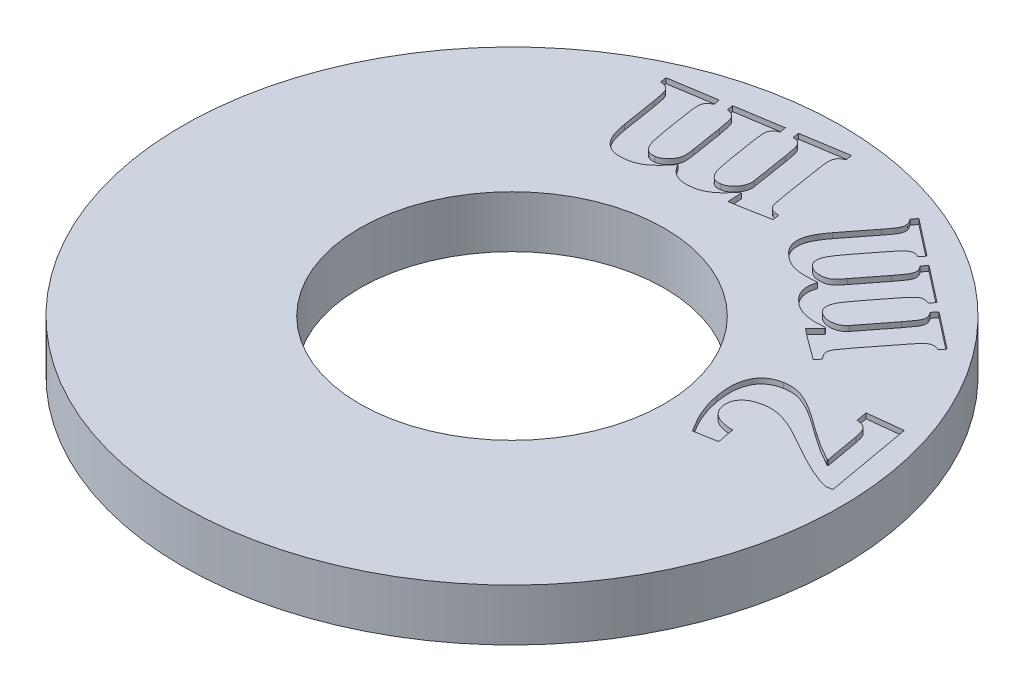
from build123d import *

# Parameters (mm, degrees)
SKETCH1_R           = 12.7
BOSS_EXTRUDE1_DEPTH = 2
SKETCH2_R           = 5.8674
CUT_EXTRUDE1_DEPTH  = 19.071524562
CUT_EXTRUDE2_DEPTH  = 0.2


with BuildPart() as part:
    # Sketch1 → Boss-Extrude1 (new body)
    with BuildSketch(Plane(origin=(0, 0, 0), x_dir=(1, 0, 0), z_dir=(0, 1, 0))):
        Circle(SKETCH1_R)
    extrude(amount=BOSS_EXTRUDE1_DEPTH)

    # Sketch2 → Cut-Extrude1 (cut, through all)
    with BuildSketch(Plane(origin=(0, 0, 0), x_dir=(-1, 0, 0), z_dir=(0, -1, 0))):
        Circle(SKETCH2_R)
    extrude(amount=-CUT_EXTRUDE1_DEPTH, mode=Mode.SUBTRACT)

    # Sketch4 → Cut-Extrude2 (cut)
    with BuildSketch(Plane(origin=(0, 2, 0), x_dir=(1, 0, 0), z_dir=(0, 1, 0))):
        with BuildLine():
            add(Edge.make_bspline(
                [(10.657175979, 2.594019097), (10.65013064, 2.630831583), (10.636969406, 2.699600141), (10.614138172, 2.794705295), (10.589733244, 2.874375061), (10.561272904, 2.939067494), (10.531020983, 2.99353319), (10.494812939, 3.038568652), (10.452899957, 3.075923763), (10.405274192, 3.106357847), (10.349988215, 3.13102197), (10.285264647, 3.148965447), (10.210866978, 3.163737215), (10.157483095, 3.168212073), (10.129111743, 3.170590278)],
                knots=[0, 0, 0, 0, 1.540311631, 2.877420744, 4.019047234, 4.959142214, 5.777829076, 6.572764425, 7.321593786, 8.075735676, 8.887004588, 9.799891039, 10.830732, 12, 12, 12, 12], degree=3))
            Line((10.129111743, 3.170590278), (10.054146465, 3.590616319))
            Line((10.054146465, 3.590616319), (11.377063132, 3.739444444))
            Line((11.377063132, 3.739444444), (11.972375632, 0.394670139))
            Line((11.972375632, 0.394670139), (11.73094334, 0.351675347))
            add(Edge.make_bspline(
                [(11.73094334, 0.351675347), (11.666021298, 0.368480839), (11.531212131, 0.403377067), (11.326414737, 0.474445449), (11.110180307, 0.559425855), (10.882988887, 0.660070864), (10.645158868, 0.776715276), (10.394395938, 0.905922065), (10.131048372, 1.048986702), (9.9528541, 1.151989425), (9.861221118, 1.204956597)],
                knots=[0, 0, 0, 0, 0.780349875, 1.620379058, 2.521161756, 3.484490423, 4.511830184, 5.604229563, 6.768021061, 8, 8, 8, 8], degree=3))
            add(Edge.make_bspline(
                [(9.861221118, 1.204956597), (9.776443058, 1.253652173), (9.615930318, 1.345848907), (9.387059411, 1.473484458), (9.181803351, 1.579516376), (8.998168575, 1.667527983), (8.830111188, 1.739289307), (8.671736429, 1.799305225), (8.518737568, 1.8433924), (8.371972803, 1.879309741), (8.228064992, 1.900559713), (8.085286383, 1.908174145), (7.94232826, 1.903319711), (7.848085123, 1.889024598), (7.80077841, 1.881848958)],
                knots=[0, 0, 0, 0, 1.588748718, 3.008023671, 4.257940554, 5.342391522, 6.316243066, 7.226933507, 8.092329584, 8.902015177, 9.680651395, 10.452110241, 11.223014214, 12, 12, 12, 12], degree=3))
            add(Edge.make_bspline(
                [(7.80077841, 1.881848958), (7.737810367, 1.868570311), (7.617604939, 1.843221491), (7.453187274, 1.778906093), (7.312606985, 1.697337928), (7.217707497, 1.610851073), (7.156248473, 1.534763117), (7.11835972, 1.475393068), (7.090083841, 1.412684467), (7.066648765, 1.348152535), (7.054692086, 1.279597589), (7.047209551, 1.208811476), (7.049839269, 1.135133242), (7.057246716, 1.085833888), (7.061047507, 1.060538194)],
                knots=[0, 0, 0, 0, 1.856671383, 3.544368997, 5.077513395, 6.528031651, 7.222788016, 7.900293924, 8.555813474, 9.207192858, 9.877674324, 10.560153428, 11.261209002, 12, 12, 12, 12], degree=3))
            add(Edge.make_bspline(
                [(7.061047507, 1.060538194), (7.071502485, 1.013917266), (7.091847681, 0.923193798), (7.156333505, 0.800294722), (7.242613348, 0.694498267), (7.333740463, 0.622353436), (7.417801846, 0.575049385), (7.488441553, 0.542731657), (7.566717952, 0.516901122), (7.650772556, 0.493347798), (7.742391153, 0.476481532), (7.840439275, 0.461498893), (7.945805633, 0.453265626), (8.018314011, 0.450968067), (8.055439868, 0.449791667)],
                knots=[0, 0, 0, 0, 1.33944009, 2.606525719, 3.862934898, 5.158019576, 5.84800628, 6.574523544, 7.339672684, 8.164919944, 9.0287774, 9.958789578, 10.954856145, 12, 12, 12, 12], degree=3))
            Line((8.055439868, 0.449791667), (8.172297507, -0.207256944))
            Line((8.172297507, -0.207256944), (7.310196812, -0.360494792))
            add(Edge.make_bspline(
                [(7.310196812, -0.360494792), (7.269943559, -0.295206555), (7.194332463, -0.172570127), (7.091280305, 0.001165699), (7.007559915, 0.153805397), (6.917495892, 0.325751817), (6.828566235, 0.528709765), (6.734746947, 0.771533586), (6.660981212, 1.028705946), (6.626054599, 1.207222275), (6.607948548, 1.299765625)],
                knots=[0, 0, 0, 0, 1.013852355, 1.904404784, 2.669660784, 3.314893955, 4.4694696, 5.596276395, 6.753903144, 8, 8, 8, 8], degree=3))
            add(Edge.make_bspline(
                [(6.607948548, 1.299765625), (6.594373085, 1.385581768), (6.568481438, 1.549253623), (6.554034422, 1.786495935), (6.559902757, 2.002451995), (6.590743901, 2.197205894), (6.641439791, 2.370424151), (6.708565837, 2.523254421), (6.792300347, 2.655975238), (6.896085737, 2.76542574), (7.014232975, 2.855427337), (7.146085533, 2.927207536), (7.290765983, 2.983855708), (7.39392888, 3.005259932), (7.446898201, 3.01625)],
                knots=[0, 0, 0, 0, 1.443267886, 2.752656116, 3.944361917, 5.026747142, 6.020055427, 6.935958526, 7.793169878, 8.6141069, 9.428864088, 10.251639209, 11.102298531, 12, 12, 12, 12], degree=3))
            add(Edge.make_bspline(
                [(7.446898201, 3.01625), (7.494563647, 3.02346036), (7.588424347, 3.037658685), (7.729716904, 3.04210554), (7.868111573, 3.030406083), (8.006902768, 3.006267175), (8.149697995, 2.963320645), (8.302330261, 2.904522597), (8.466281885, 2.826207866), (8.611654299, 2.748407674), (8.737278614, 2.673549672), (8.844909038, 2.607699414), (8.96123916, 2.529289408), (9.090383567, 2.444265965), (9.229102901, 2.348034363), (9.378074292, 2.241872945), (9.537955368, 2.126144512), (9.647783356, 2.045099111), (9.704675979, 2.003116319)],
                knots=[0, 0, 0, 0, 0.908484052, 1.788946884, 2.657881961, 3.523717051, 4.440330464, 5.464678491, 6.605413212, 7.864114422, 8.572400302, 9.362740296, 10.242957687, 11.217337518, 12.278341761, 13.426209815, 14.666736238, 16, 16, 16, 16], degree=3))
            add(Edge.make_bspline(
                [(9.704675979, 2.003116319), (9.811805931, 1.92809611), (10.023407319, 1.779917378), (10.291371818, 1.609086139), (10.497607624, 1.48887768), (10.631292817, 1.409907135), (10.747529002, 1.346035088), (10.818829378, 1.308148721), (10.851203757, 1.290946181)],
                knots=[0, 0, 0, 0, 1.742825355, 3.442401069, 4.232730782, 4.923996937, 5.511434123, 6, 6, 6, 6], degree=3))
            Line((10.851203757, 1.290946181), (10.887583965, 1.297560764))
            Line((10.887583965, 1.297560764), (10.657175979, 2.594019097))
        make_face()
        with BuildLine():
            Line((6.446112276, 5.621046804), (6.418551512, 5.656324582))
            add(Edge.make_bspline(
                [(6.418551512, 5.656324582), (6.345103003, 5.650481726), (6.205690041, 5.639391375), (6.006049673, 5.640001619), (5.827169527, 5.650699674), (5.666856777, 5.67597167), (5.521469939, 5.714933464), (5.387561193, 5.768451828), (5.261579098, 5.83414063), (5.185430088, 5.889090651), (5.147449081, 5.916498193)],
                knots=[0, 0, 0, 0, 1.328700104, 2.522011983, 3.598465663, 4.558669638, 5.444794913, 6.307777922, 7.155966722, 8, 8, 8, 8], degree=3))
            add(Edge.make_bspline(
                [(5.147449081, 5.916498193), (5.113549109, 5.943897718), (5.048106477, 5.996791479), (4.961452983, 6.081290035), (4.888569595, 6.165417061), (4.830459206, 6.250285271), (4.784446219, 6.336029232), (4.750511209, 6.423590405), (4.725338541, 6.51279674), (4.712276312, 6.605066622), (4.710185373, 6.700889708), (4.719470407, 6.800614492), (4.739279008, 6.904788894), (4.760550248, 6.974274273), (4.771520262, 7.010109304)],
                knots=[0, 0, 0, 0, 1.254723853, 2.422197594, 3.480533536, 4.455073735, 5.378270259, 6.276377898, 7.154433995, 8.041941717, 8.952311201, 9.908521309, 10.921381655, 12, 12, 12, 12], degree=3))
            add(Edge.make_bspline(
                [(4.771520262, 7.010109304), (4.691090698, 7.003656459), (4.538471998, 6.991411896), (4.321666343, 6.98846259), (4.129911724, 6.995416816), (3.960718577, 7.018564153), (3.808601542, 7.056299759), (3.667745769, 7.110172456), (3.535147857, 7.17881181), (3.454567942, 7.236924978), (3.414428248, 7.265873193)],
                knots=[0, 0, 0, 0, 1.366310217, 2.59263486, 3.670585393, 4.613332156, 5.479848919, 6.319088227, 7.162678639, 8, 8, 8, 8], degree=3))
            add(Edge.make_bspline(
                [(3.414428248, 7.265873193), (3.3775521, 7.295803428), (3.306764809, 7.353257376), (3.21306857, 7.444735382), (3.134735925, 7.535260481), (3.072420666, 7.626680072), (3.027114725, 7.721083516), (2.993029681, 7.816985205), (2.9748084, 7.916670154), (2.967827049, 8.01881721), (2.974809687, 8.124007378), (2.995095498, 8.231959079), (3.028806982, 8.342103336), (3.074329878, 8.45600405), (3.135236882, 8.572567121), (3.206795227, 8.695687314), (3.293019282, 8.822881794), (3.357079528, 8.907680315), (3.390174776, 8.951489512)],
                knots=[0, 0, 0, 0, 1.169264857, 2.244515684, 3.220319539, 4.113963992, 4.959955291, 5.792870505, 6.612950669, 7.447388896, 8.308923635, 9.201834464, 10.146760853, 11.141726431, 12.218423767, 13.382633535, 14.647798067, 16, 16, 16, 16], degree=3))
            Line((3.390174776, 8.951489512), (4.221407414, 10.019744721))
            add(Edge.make_bspline(
                [(4.221407414, 10.019744721), (4.253451667, 10.061583607), (4.315528507, 10.14263483), (4.402700621, 10.258852189), (4.474099835, 10.363054012), (4.52285553, 10.455601314), (4.552580969, 10.535251364), (4.563466398, 10.608503251), (4.558254548, 10.679867299), (4.53147758, 10.75154504), (4.489681708, 10.826689156), (4.454202161, 10.876320457), (4.435278942, 10.902791596)],
                knots=[0, 0, 0, 0, 1.558183804, 3.018548385, 4.296309646, 5.28770402, 6.105589718, 6.797073249, 7.462098622, 8.197436721, 9.038592567, 10, 10, 10, 10], degree=3))
            Line((4.435278942, 10.902791596), (4.585209498, 11.095716943))
            Line((4.585209498, 11.095716943), (5.996320609, 9.99769611))
            Line((5.996320609, 9.99769611), (5.846390053, 9.804770762))
            add(Edge.make_bspline(
                [(5.846390053, 9.804770762), (5.821598554, 9.814853431), (5.775331585, 9.833670142), (5.707363836, 9.85237221), (5.646143658, 9.858436215), (5.590929353, 9.853196728), (5.540343575, 9.836119226), (5.490007513, 9.81172786), (5.439948532, 9.776609976), (5.384915117, 9.732987716), (5.324969903, 9.670799848), (5.252764521, 9.589061458), (5.16514284, 9.485038198), (5.10380747, 9.40664927), (5.070278942, 9.36379854)],
                knots=[0, 0, 0, 0, 0.974495288, 1.818645247, 2.55789592, 3.203887047, 3.821953837, 4.492443581, 5.234959137, 6.043992897, 7.047297203, 8.374577793, 10.01818969, 12, 12, 12, 12], degree=3))
            Line((5.070278942, 9.36379854), (4.459532414, 8.578867985))
            add(Edge.make_bspline(
                [(4.459532414, 8.578867985), (4.427040039, 8.536727017), (4.36533113, 8.456693682), (4.279860313, 8.340926267), (4.207480509, 8.23488918), (4.144743666, 8.140152652), (4.093939387, 8.053261371), (4.055224804, 7.972382939), (4.025674683, 7.897486598), (4.007618905, 7.827463577), (3.999758774, 7.762907557), (3.999966382, 7.703395202), (4.005428339, 7.648104338), (4.021722039, 7.597238119), (4.045740851, 7.549179791), (4.078974228, 7.503189368), (4.121883321, 7.458704343), (4.154616135, 7.431294161), (4.171798039, 7.416906179)],
                knots=[0, 0, 0, 0, 1.888953508, 3.587465034, 5.107152686, 6.445866775, 7.620537267, 8.676590056, 9.626254862, 10.474157069, 11.23623705, 11.927603465, 12.58451522, 13.199276758, 13.811819934, 14.485105834, 15.204811187, 16, 16, 16, 16], degree=3))
            add(Edge.make_bspline(
                [(4.171798039, 7.416906179), (4.196907921, 7.398623115), (4.24575502, 7.363056452), (4.329546375, 7.32690278), (4.419900083, 7.306286873), (4.515987475, 7.298075567), (4.611843152, 7.301326536), (4.703352488, 7.308761322), (4.788476175, 7.328417137), (4.868537558, 7.362467429), (4.944132959, 7.410449543), (5.003782637, 7.463505766), (5.054181963, 7.517595359), (5.101176163, 7.571027473), (5.155289779, 7.638105142), (5.193805445, 7.686959904), (5.214697345, 7.713459999)],
                knots=[0, 0, 0, 0, 1.060451807, 2.062932707, 3.097103212, 4.220994073, 5.353228603, 6.376944908, 7.359261765, 8.328691766, 9.340596163, 10.410182602, 11.05076008, 11.870698325, 12.845011315, 14, 14, 14, 14], degree=3))
            Line((5.214697345, 7.713459999), (5.957735539, 8.66816486))
            add(Edge.make_bspline(
                [(5.957735539, 8.66816486), (5.982092993, 8.699319813), (6.027952625, 8.757977615), (6.090423825, 8.841053313), (6.142342187, 8.913544593), (6.197870379, 8.990195), (6.249297759, 9.073408186), (6.29114706, 9.165636672), (6.310604917, 9.252795431), (6.30324831, 9.324426645), (6.285186466, 9.381667531), (6.264023921, 9.429739499), (6.232698883, 9.48084353), (6.207857504, 9.515367573), (6.194758109, 9.533572846)],
                knots=[0, 0, 0, 0, 1.428852229, 2.69020885, 3.755221618, 4.650440021, 6.110052653, 7.281631402, 8.297160143, 9.297295893, 9.839073942, 10.463254767, 11.189641066, 12, 12, 12, 12], degree=3))
            Line((6.194758109, 9.533572846), (6.344688664, 9.726498193))
            Line((6.344688664, 9.726498193), (7.739263317, 8.640604096))
            Line((7.739263317, 8.640604096), (7.589332762, 8.447678749))
            add(Edge.make_bspline(
                [(7.589332762, 8.447678749), (7.564184317, 8.458169169), (7.516888214, 8.477898261), (7.447738497, 8.497032573), (7.385486432, 8.504959726), (7.329450384, 8.499379022), (7.278376194, 8.482329334), (7.227319552, 8.459564119), (7.178554253, 8.423744301), (7.124521011, 8.380289164), (7.065790511, 8.31767881), (6.99307334, 8.236382683), (6.90602346, 8.130825514), (6.84391499, 8.052041093), (6.809914359, 8.008911387)],
                knots=[0, 0, 0, 0, 0.986342731, 1.854992093, 2.591493093, 3.247165752, 3.874524497, 4.535580437, 5.263002682, 6.057269968, 7.045676649, 8.365642244, 10.010408946, 12, 12, 12, 12], degree=3))
            Line((6.809914359, 8.008911387), (6.199167831, 7.223980832))
            add(Edge.make_bspline(
                [(6.199167831, 7.223980832), (6.1751448, 7.193217202), (6.128820384, 7.133894666), (6.064470667, 7.047003547), (6.005667413, 6.967536238), (5.953399564, 6.894695326), (5.908577343, 6.827540339), (5.869029665, 6.766708727), (5.837481339, 6.710333021), (5.802625077, 6.644943933), (5.770963015, 6.567952334), (5.744339164, 6.480543218), (5.734321689, 6.398573054), (5.736407268, 6.323235217), (5.755317287, 6.253747629), (5.786992728, 6.186877603), (5.838949571, 6.122592111), (5.883831274, 6.085438123), (5.908126164, 6.065326318)],
                knots=[0, 0, 0, 0, 1.387103131, 2.674797394, 3.842386028, 4.900548409, 5.86041802, 6.711809731, 7.478006622, 8.155605191, 9.344042684, 10.43114453, 11.391724629, 12.267604767, 13.091197959, 13.932310922, 14.880740337, 16, 16, 16, 16], degree=3))
            add(Edge.make_bspline(
                [(5.908126164, 6.065326318), (5.92724958, 6.05188526), (5.966036324, 6.024623661), (6.032692056, 5.993550347), (6.107049239, 5.971043667), (6.187819264, 5.954527731), (6.272883487, 5.946510823), (6.359519721, 5.950174322), (6.446294721, 5.963823989), (6.53258789, 5.986026651), (6.614596751, 6.020389001), (6.690833791, 6.063035119), (6.757619821, 6.117520035), (6.794712531, 6.160658186), (6.813221651, 6.182183957)],
                knots=[0, 0, 0, 0, 0.841485411, 1.706728545, 2.636983739, 3.637338779, 4.674903333, 5.709078804, 6.7546484, 7.837656936, 8.912857559, 9.95143668, 10.977774795, 12, 12, 12, 12], degree=3))
            Line((6.813221651, 6.182183957), (7.695166095, 7.315482568))
            add(Edge.make_bspline(
                [(7.695166095, 7.315482568), (7.728014018, 7.358000395), (7.788496594, 7.436288075), (7.869304066, 7.544976045), (7.931241751, 7.634991871), (7.976730187, 7.708273557), (8.008966806, 7.771056115), (8.029709996, 7.829288183), (8.042924298, 7.885143031), (8.045069208, 7.940051692), (8.037490603, 7.996136863), (8.014924563, 8.054405487), (7.980117392, 8.116225886), (7.950303267, 8.156952636), (7.934393526, 8.178685693)],
                knots=[0, 0, 0, 0, 1.946253878, 3.583619155, 4.90541557, 5.903065839, 6.706730513, 7.456203084, 8.137693296, 8.777198399, 9.436082692, 10.17303834, 11.025076595, 12, 12, 12, 12], degree=3))
            Line((7.934393526, 8.178685693), (8.084324081, 8.37161104))
            Line((8.084324081, 8.37161104), (9.487718178, 7.27910236))
            Line((9.487718178, 7.27910236), (9.337787623, 7.086177012))
            add(Edge.make_bspline(
                [(9.337787623, 7.086177012), (9.310775429, 7.0966318), (9.260723911, 7.116003717), (9.187673864, 7.135537847), (9.123019149, 7.144452452), (9.064830325, 7.140087962), (9.012522306, 7.124265196), (8.960801373, 7.102391813), (8.910212078, 7.069482703), (8.856472687, 7.026121446), (8.796761068, 6.965984534), (8.724427609, 6.885322286), (8.638553239, 6.78089514), (8.576615815, 6.702998059), (8.542935192, 6.660638818)],
                knots=[0, 0, 0, 0, 1.0399122, 1.926877353, 2.71123319, 3.373420874, 4.004478301, 4.666665984, 5.384545304, 6.163885671, 7.144097132, 8.424650005, 10.055779381, 12, 12, 12, 12], degree=3))
            Line((8.542935192, 6.660638818), (7.60586922, 5.456784651))
            add(Edge.make_bspline(
                [(7.60586922, 5.456784651), (7.579695927, 5.423041412), (7.531000421, 5.360261992), (7.464615767, 5.272214489), (7.410772827, 5.196862452), (7.35505243, 5.118965683), (7.3062141, 5.034369264), (7.266301268, 4.941020505), (7.257033, 4.850826575), (7.268994039, 4.777697278), (7.294307526, 4.717385158), (7.326608903, 4.665864149), (7.367927347, 4.606464412), (7.401556879, 4.566478611), (7.419558456, 4.545074582)],
                knots=[0, 0, 0, 0, 1.450639645, 2.698920323, 3.745170182, 4.597024574, 5.950243738, 7.060652374, 8.014587129, 8.989365666, 9.543411076, 10.226324432, 11.050567859, 12, 12, 12, 12], degree=3))
            Line((7.419558456, 4.545074582), (7.264115748, 4.345534651))
            Line((7.264115748, 4.345534651), (6.442804984, 4.947461735))
            Line((6.442804984, 4.947461735), (6.074593178, 5.234093679))
            Line((6.074593178, 5.234093679), (6.446112276, 5.621046804))
        make_face()
        with BuildLine():
            Line((0.313853362, 8.525956305), (0.266448848, 8.530366027))
            add(Edge.make_bspline(
                [(0.266448848, 8.530366027), (0.220587801, 8.472712263), (0.133110419, 8.362740934), (-0.004365315, 8.216579062), (-0.134419634, 8.091399905), (-0.26345541, 7.991600635), (-0.391287899, 7.911021784), (-0.522521219, 7.849326117), (-0.657183893, 7.801559088), (-0.750062007, 7.783960964), (-0.796294208, 7.775201097)],
                knots=[0, 0, 0, 0, 1.321709555, 2.521087024, 3.598960819, 4.558109064, 5.44394598, 6.305457593, 7.156502851, 8, 8, 8, 8], degree=3))
            add(Edge.make_bspline(
                [(-0.796294208, 7.775201097), (-0.839944877, 7.768960851), (-0.923669459, 7.756991687), (-1.045452622, 7.751329453), (-1.157309896, 7.756606178), (-1.259753383, 7.771731323), (-1.354164127, 7.797300062), (-1.441453203, 7.833576517), (-1.52489044, 7.87569231), (-1.601582422, 7.92961482), (-1.673310621, 7.993632909), (-1.739982334, 8.068486542), (-1.802626549, 8.154631273), (-1.839037783, 8.217645133), (-1.857934833, 8.250348666)],
                knots=[0, 0, 0, 0, 1.262383675, 2.421327046, 3.485651979, 4.465097507, 5.381738202, 6.278834679, 7.168553644, 8.05321575, 8.955237983, 9.91670527, 10.918791849, 12, 12, 12, 12], degree=3))
            add(Edge.make_bspline(
                [(-1.857934833, 8.250348666), (-1.90877596, 8.187008607), (-2.00522163, 8.066852448), (-2.151117808, 7.90429903), (-2.290041501, 7.770169918), (-2.42237, 7.660920578), (-2.554191293, 7.574649228), (-2.690177048, 7.508178238), (-2.831656224, 7.457141582), (-2.929902909, 7.438416019), (-2.979106708, 7.429037902)],
                knots=[0, 0, 0, 0, 1.367019779, 2.593237953, 3.673809289, 4.614754209, 5.477752088, 6.31872209, 7.157984213, 8, 8, 8, 8], degree=3))
            add(Edge.make_bspline(
                [(-2.979106708, 7.429037902), (-3.026059084, 7.422313077), (-3.116363637, 7.40937907), (-3.247369376, 7.404275703), (-3.367795645, 7.408861262), (-3.477868354, 7.42618411), (-3.579049507, 7.456379764), (-3.672210418, 7.498761458), (-3.759200344, 7.552032666), (-3.839177412, 7.617470965), (-3.910830954, 7.695734725), (-3.976479508, 7.784665243), (-4.034537182, 7.885532337), (-4.086457137, 7.997681719), (-4.132118696, 8.122243067), (-4.168735586, 8.260041405), (-4.205840999, 8.409494464), (-4.222701413, 8.514404278), (-4.231467819, 8.568951097)],
                knots=[0, 0, 0, 0, 1.161439086, 2.233821674, 3.207260032, 4.110189863, 4.956199937, 5.786297692, 6.610908432, 7.449024294, 8.309099073, 9.204093284, 10.152261841, 11.155272774, 12.229128442, 13.397873342, 14.647050006, 16, 16, 16, 16], degree=3))
            Line((-4.231467819, 8.568951097), (-4.445339347, 9.915018805))
            add(Edge.make_bspline(
                [(-4.445339347, 9.915018805), (-4.453968854, 9.967233872), (-4.470648589, 10.068158929), (-4.49743887, 10.211380795), (-4.524685526, 10.335077023), (-4.557401262, 10.434852747), (-4.596893377, 10.510944501), (-4.643015377, 10.569856606), (-4.700587884, 10.614839055), (-4.771670566, 10.64401948), (-4.854978101, 10.666808477), (-4.91554102, 10.67330914), (-4.94804768, 10.676798319)],
                knots=[0, 0, 0, 0, 1.556776784, 3.009050718, 4.285993182, 5.280798359, 6.088364277, 6.795732101, 7.466033526, 8.211290206, 9.039924425, 10, 10, 10, 10], degree=3))
            Line((-4.94804768, 10.676798319), (-4.986632749, 10.920435472))
            Line((-4.986632749, 10.920435472), (-3.209514694, 11.202657694))
            Line((-3.209514694, 11.202657694), (-3.170929624, 10.959020541))
            add(Edge.make_bspline(
                [(-3.170929624, 10.959020541), (-3.1955222, 10.948274173), (-3.241636376, 10.928123379), (-3.301383001, 10.890257762), (-3.349616556, 10.851198802), (-3.382533123, 10.806155645), (-3.405703355, 10.757404121), (-3.419878086, 10.703054317), (-3.431779295, 10.642767853), (-3.435574724, 10.57245081), (-3.432618312, 10.485524547), (-3.422064489, 10.375927445), (-3.403820359, 10.240039117), (-3.388657088, 10.140990442), (-3.38039143, 10.086997972)],
                knots=[0, 0, 0, 0, 0.969779354, 1.818458417, 2.554157673, 3.20052523, 3.8192083, 4.496967745, 5.227358508, 6.040378365, 7.038205311, 8.373543936, 10.023180803, 12, 12, 12, 12], degree=3))
            Line((-3.38039143, 10.086997972), (-3.223846291, 9.099220194))
            add(Edge.make_bspline(
                [(-3.223846291, 9.099220194), (-3.215227763, 9.046636467), (-3.198810146, 8.946468614), (-3.172292417, 8.804233798), (-3.146374998, 8.677591368), (-3.119216219, 8.56625168), (-3.088752441, 8.469337514), (-3.058340166, 8.383915324), (-3.020988556, 8.311907887), (-2.983052645, 8.250047646), (-2.9403307, 8.200299225), (-2.896928005, 8.158691062), (-2.852193168, 8.125100637), (-2.803967184, 8.101198407), (-2.752634363, 8.085140565), (-2.695940612, 8.079901249), (-2.634163691, 8.077597969), (-2.591377829, 8.083895558), (-2.569002541, 8.087188944)],
                knots=[0, 0, 0, 0, 1.879302477, 3.579923031, 5.102516498, 6.43847557, 7.619109878, 8.685516954, 9.630316028, 10.475250734, 11.238613256, 11.935364263, 12.593814088, 13.202415535, 13.825608582, 14.478293096, 15.204208384, 16, 16, 16, 16], degree=3))
            add(Edge.make_bspline(
                [(-2.569002541, 8.087188944), (-2.538163079, 8.093382104), (-2.478532253, 8.105357128), (-2.394656651, 8.14283353), (-2.317494931, 8.195021488), (-2.24573651, 8.260419012), (-2.181107746, 8.332153066), (-2.123831091, 8.404596344), (-2.079289987, 8.480367808), (-2.050670586, 8.56285552), (-2.034279614, 8.650879435), (-2.03038681, 8.730698931), (-2.035644191, 8.804578121), (-2.042089163, 8.876314479), (-2.053342192, 8.963059354), (-2.063191476, 9.025749928), (-2.068499069, 9.059532694)],
                knots=[0, 0, 0, 0, 1.066239177, 2.061667717, 3.097334799, 4.220563205, 5.352161382, 6.376319012, 7.355316561, 8.323097728, 9.327340028, 10.390062672, 11.0280924, 11.843315407, 12.837803384, 14, 14, 14, 14], degree=3))
            Line((-2.068499069, 9.059532694), (-2.259219555, 10.261182))
            add(Edge.make_bspline(
                [(-2.259219555, 10.261182), (-2.265189068, 10.300550507), (-2.276367674, 10.374272601), (-2.296122881, 10.476856372), (-2.311449485, 10.565092055), (-2.333244723, 10.658190139), (-2.357413956, 10.753633086), (-2.397599585, 10.847457095), (-2.4488931, 10.920993429), (-2.506101212, 10.965507213), (-2.560536594, 10.991486992), (-2.609969791, 11.008449388), (-2.668336298, 11.019413766), (-2.710093776, 11.025341112), (-2.732162263, 11.028473666)],
                knots=[0, 0, 0, 0, 1.433434736, 2.68427268, 3.761168802, 4.656659373, 6.126928261, 7.29968854, 8.313279962, 9.321676997, 9.866066009, 10.48111294, 11.19728056, 12, 12, 12, 12], degree=3))
            Line((-2.732162263, 11.028473666), (-2.770747333, 11.272110819))
            Line((-2.770747333, 11.272110819), (-1.016780319, 11.549923319))
            Line((-1.016780319, 11.549923319), (-0.978195249, 11.306286166))
            add(Edge.make_bspline(
                [(-0.978195249, 11.306286166), (-1.003539507, 11.295588296), (-1.05081222, 11.275634372), (-1.111895494, 11.237496403), (-1.161160656, 11.198478729), (-1.195529293, 11.153275612), (-1.219332957, 11.104376677), (-1.233858811, 11.049994325), (-1.245845766, 10.990428501), (-1.248131032, 10.920389717), (-1.244252884, 10.834232839), (-1.232099021, 10.724754883), (-1.214563153, 10.58839066), (-1.199286672, 10.488617856), (-1.190964347, 10.434263597)],
                knots=[0, 0, 0, 0, 0.989028705, 1.844759954, 2.586937196, 3.238107674, 3.871415783, 4.533125195, 5.259921945, 6.054965184, 7.048323037, 8.365174644, 10.01981869, 12, 12, 12, 12], degree=3))
            Line((-1.190964347, 10.434263597), (-1.034419208, 9.446485819))
            add(Edge.make_bspline(
                [(-1.034419208, 9.446485819), (-1.028284705, 9.407515179), (-1.016522902, 9.332796012), (-0.997794986, 9.225472348), (-0.978788568, 9.127843148), (-0.957118142, 9.015092544), (-0.92713746, 8.896731465), (-0.890202667, 8.776099361), (-0.846829242, 8.680304169), (-0.799827341, 8.60076994), (-0.746857119, 8.537114013), (-0.691097612, 8.485253813), (-0.626591832, 8.452528987), (-0.556339665, 8.428456815), (-0.472992748, 8.422934964), (-0.414757912, 8.430379669), (-0.382882749, 8.434454569)],
                knots=[0, 0, 0, 0, 1.217997893, 2.335291105, 3.363301837, 4.288921831, 5.879406356, 7.131588601, 8.17759787, 9.119347984, 9.973511448, 10.729163452, 11.449941662, 12.189059626, 13.008771681, 14, 14, 14, 14], degree=3))
            add(Edge.make_bspline(
                [(-0.382882749, 8.434454569), (-0.359875434, 8.438812656), (-0.312670065, 8.447754381), (-0.244525142, 8.476737934), (-0.176304789, 8.514964956), (-0.108641116, 8.562544432), (-0.045650694, 8.620933806), (0.012522922, 8.686043096), (0.061956884, 8.7593599), (0.103685428, 8.838283335), (0.136408142, 8.921606199), (0.154309625, 9.007588437), (0.162701488, 9.094558661), (0.155463208, 9.151799875), (0.15179607, 9.180800055)],
                knots=[0, 0, 0, 0, 0.835871289, 1.715002913, 2.633388593, 3.633187471, 4.666417129, 5.700650574, 6.751143417, 7.821774814, 8.891517419, 9.941351542, 10.95702464, 12, 12, 12, 12], degree=3))
            Line((0.15179607, 9.180800055), (-0.074202194, 10.607345194))
            add(Edge.make_bspline(
                [(-0.074202194, 10.607345194), (-0.0827033, 10.660686047), (-0.098328527, 10.758727753), (-0.124174258, 10.892356055), (-0.146107794, 11.000081328), (-0.168777011, 11.084461368), (-0.192328462, 11.151581226), (-0.219827574, 11.207320309), (-0.252192214, 11.254760428), (-0.290360467, 11.294727515), (-0.337845169, 11.326906546), (-0.395953257, 11.350746254), (-0.4656423, 11.366694908), (-0.515833552, 11.372583246), (-0.54273518, 11.375739291)],
                knots=[0, 0, 0, 0, 1.944391131, 3.573835333, 4.89976862, 5.901119108, 6.717182758, 7.456739864, 8.131968056, 8.777512876, 9.434346179, 10.181320822, 11.025219969, 12, 12, 12, 12], degree=3))
            Line((-0.54273518, 11.375739291), (-0.581320249, 11.619376444))
            Line((-0.581320249, 11.619376444), (1.18367107, 11.898291375))
            Line((1.18367107, 11.898291375), (1.22225614, 11.654654222))
            add(Edge.make_bspline(
                [(1.22225614, 11.654654222), (1.19625358, 11.642320887), (1.14785195, 11.619363395), (1.083956718, 11.579411666), (1.033199809, 11.537997656), (0.996115313, 11.492400193), (0.971907979, 11.442441633), (0.952327319, 11.389471255), (0.942318303, 11.329790665), (0.936003298, 11.261211079), (0.939860158, 11.175976409), (0.950170447, 11.067904886), (0.968541079, 10.933108835), (0.983606087, 10.834419647), (0.991848153, 10.780426791)],
                knots=[0, 0, 0, 0, 1.029437697, 1.916213766, 2.690941621, 3.364738409, 4.000075764, 4.6698806, 5.379325844, 6.158174325, 7.131901521, 8.426385959, 10.044875728, 12, 12, 12, 12], degree=3))
            Line((0.991848153, 10.780426791), (1.231075584, 9.265687208))
            add(Edge.make_bspline(
                [(1.231075584, 9.265687208), (1.237812541, 9.223017488), (1.250316557, 9.14382107), (1.271234809, 9.034259492), (1.286790608, 8.942078167), (1.306037446, 8.847585285), (1.33297969, 8.753531648), (1.375000791, 8.660340036), (1.434691793, 8.591618497), (1.496545931, 8.549250257), (1.558872086, 8.528494985), (1.618128233, 8.514144363), (1.690939166, 8.504851265), (1.743684451, 8.501383727), (1.772368987, 8.499497972)],
                knots=[0, 0, 0, 0, 1.45510247, 2.700718576, 3.757006257, 4.604314627, 5.947710583, 7.049444465, 8.014850273, 8.979620945, 9.531703584, 10.219269411, 11.031582988, 12, 12, 12, 12], degree=3))
            Line((1.772368987, 8.499497972), (1.812056487, 8.249246236))
            Line((1.812056487, 8.249246236), (0.80663982, 8.05962818))
            Line((0.80663982, 8.05962818), (0.341414126, 7.985765333))
            Line((0.341414126, 7.985765333), (0.313853362, 8.525956305))
        make_face()
    extrude(amount=-CUT_EXTRUDE2_DEPTH, mode=Mode.SUBTRACT)


solid = part.part
